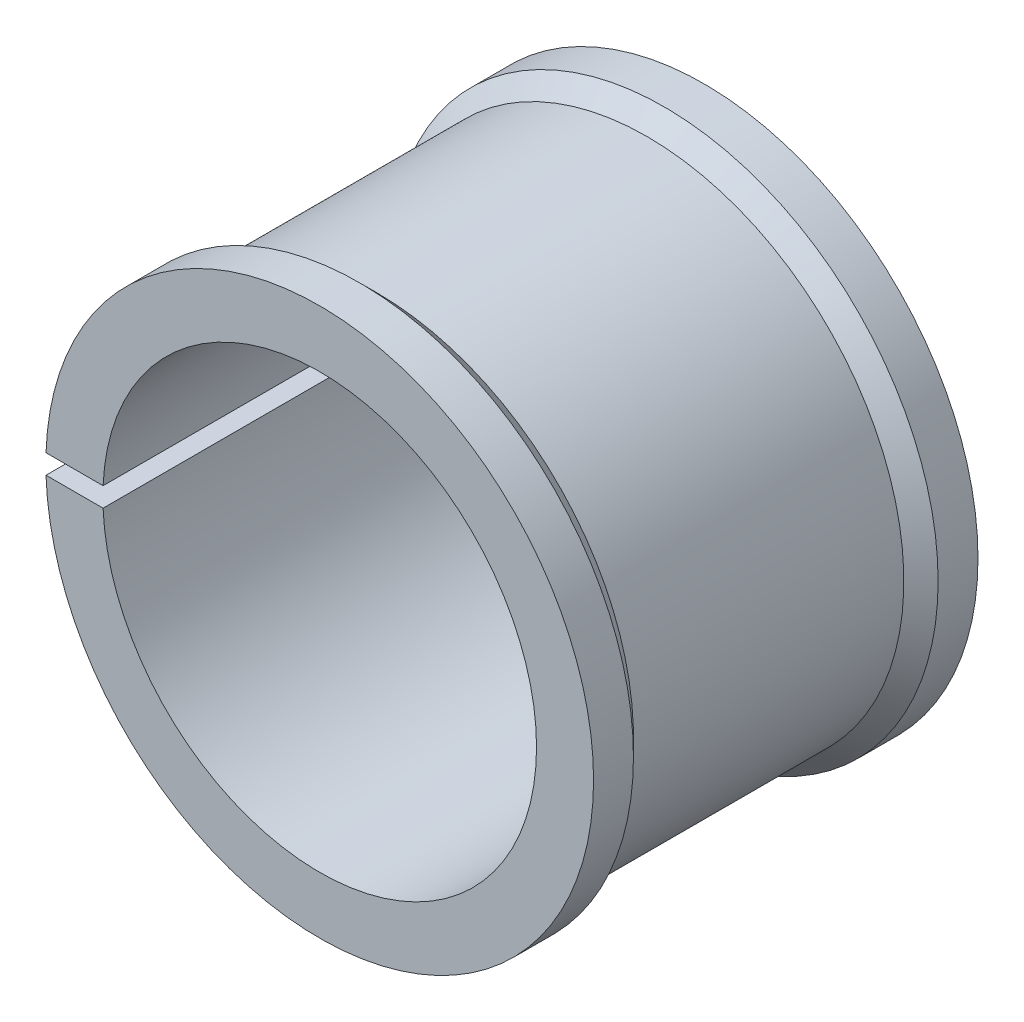
from build123d import *

# Parameters (mm, degrees)
IZIM1_R                     = 25.75
Y_KSEKLIK_EKSTR_ZYON2_DEPTH = 22.56
IZIM2_R                     = 21.75
KES_EKSTR_ZYON1_DEPTH       = 22.56
IZIM3_R                     = 27.47
Y_KSEKLIK_EKSTR_ZYON3_DEPTH = 8
PAH1_SIZE                   = 4
Y_KSEKLIK_EKSTR_ZYON4_START = 8
IZIM5_R                     = 27.47
Y_KSEKLIK_EKSTR_ZYON4_DEPTH = 8
PAH2_SIZE                   = 4
IZIM6_R                     = 21.75
KES_EKSTR_ZYON4_DEPTH       = 8
KES_EKSTR_ZYON5_START       = -8
IZIM7_R                     = 21.75
KES_EKSTR_ZYON5_DEPTH       = 8
KES_EKSTR_ZYON6_START       = -64
KES_EKSTR_ZYON6_DEPTH       = 64


with BuildPart() as part:
    # Çizim1 → Yükseklik-Ekstrüzyon2 (new body)
    with BuildSketch(Plane.XY):
        Circle(IZIM1_R)
    extrude(amount=Y_KSEKLIK_EKSTR_ZYON2_DEPTH)

    # Çizim2 → Kes-Ekstrüzyon1 (cut)
    with BuildSketch(Plane.XY.offset(22.56)):
        Circle(IZIM2_R)
    extrude(amount=-KES_EKSTR_ZYON1_DEPTH, mode=Mode.SUBTRACT)

    # Çizim3 → Yükseklik-Ekstrüzyon3 (add)
    with BuildSketch(Plane.XY.offset(22.56)):
        Circle(IZIM3_R)
    extrude(amount=Y_KSEKLIK_EKSTR_ZYON3_DEPTH)

    # Pah1
    # the kernel refuses this chamfer: 4 mm, written as the material it takes off along each edge
    with BuildSketch(Plane(origin=(0, 0, 22.56), x_dir=(1, 0, 0), z_dir=(0, -1, 0))) as pah1_piece_1_section:
        Polygon((27.47, PAH1_SIZE), (27.47 - PAH1_SIZE, 0), (27.47, 0), align=None)
    pah1_piece_1 = revolve(axis=Axis((0, 0, 22.56), (0, 0, 1)), mode=Mode.PRIVATE)
    pah1_piece_1 = pah1_piece_1 - Plane(origin=(0, 0, 25.685965648), x_dir=(1, 0, 0), z_dir=(0, 0, -1)) * Cylinder(25.75, 110, mode=Mode.PRIVATE)
    add(pah1_piece_1, mode=Mode.SUBTRACT)

    # Çizim5 → Yükseklik-Ekstrüzyon4 (add)
    with BuildSketch(Plane(origin=(0, 0, 0), x_dir=(-1, 0, 0), z_dir=(0, 0, -1)).offset(Y_KSEKLIK_EKSTR_ZYON4_START)):
        with Locations(Location((0, 0, 0), (0, 0, 180))):
            Circle(IZIM5_R)
    extrude(amount=-Y_KSEKLIK_EKSTR_ZYON4_DEPTH)

    # Pah2
    # the kernel refuses this chamfer: 4 mm, written as the material it takes off along each edge
    with BuildSketch(Plane(origin=(0, 0, 0), x_dir=(1, 0, 0), z_dir=(0, 1, 0))) as pah2_piece_1_section:
        Polygon((27.47, PAH2_SIZE), (27.47 - PAH2_SIZE, 0), (27.47, 0), align=None)
    pah2_piece_1 = revolve(axis=Axis((0, 0, 0), (0, 0, -1)), mode=Mode.PRIVATE)
    pah2_piece_1 = pah2_piece_1 - Plane(origin=(0, 0, -3.125965648), x_dir=(1, 0, 0), z_dir=(0, 0, -1)) * Cylinder(25.75, 110, mode=Mode.PRIVATE)
    add(pah2_piece_1, mode=Mode.SUBTRACT)

    # Çizim6 → Kes-Ekstrüzyon4 (cut)
    with BuildSketch(Plane.XY.offset(30.56)):
        Circle(IZIM6_R)
    extrude(amount=-KES_EKSTR_ZYON4_DEPTH, mode=Mode.SUBTRACT)

    # Çizim7 → Kes-Ekstrüzyon5 (cut)
    with BuildSketch(Plane(origin=(0, 0, -8), x_dir=(-1, 0, 0), z_dir=(0, 0, -1)).offset(KES_EKSTR_ZYON5_START)):
        with Locations(Location((0, 0, 0), (0, 0, 180))):
            Circle(IZIM7_R)
    extrude(amount=KES_EKSTR_ZYON5_DEPTH, mode=Mode.SUBTRACT)

    # Çizim8 → Kes-Ekstrüzyon6 (cut)
    with BuildSketch(Plane(origin=(0, 0, -8), x_dir=(-1, 0, 0), z_dir=(0, 0, -1)).offset(KES_EKSTR_ZYON6_START)):
        with BuildLine():
            Line((21.728135562, 0.975), (27.45269158, 0.975))
            ThreePointArc((27.45269158, 0.975), (27.47, 0), (27.45269158, -0.975))
            Line((27.45269158, -0.975), (21.728135562, -0.975))
            ThreePointArc((21.728135562, -0.975), (21.75, 0), (21.728135562, 0.975))
        make_face()
    extrude(amount=KES_EKSTR_ZYON6_DEPTH, mode=Mode.SUBTRACT)


solid = part.part
